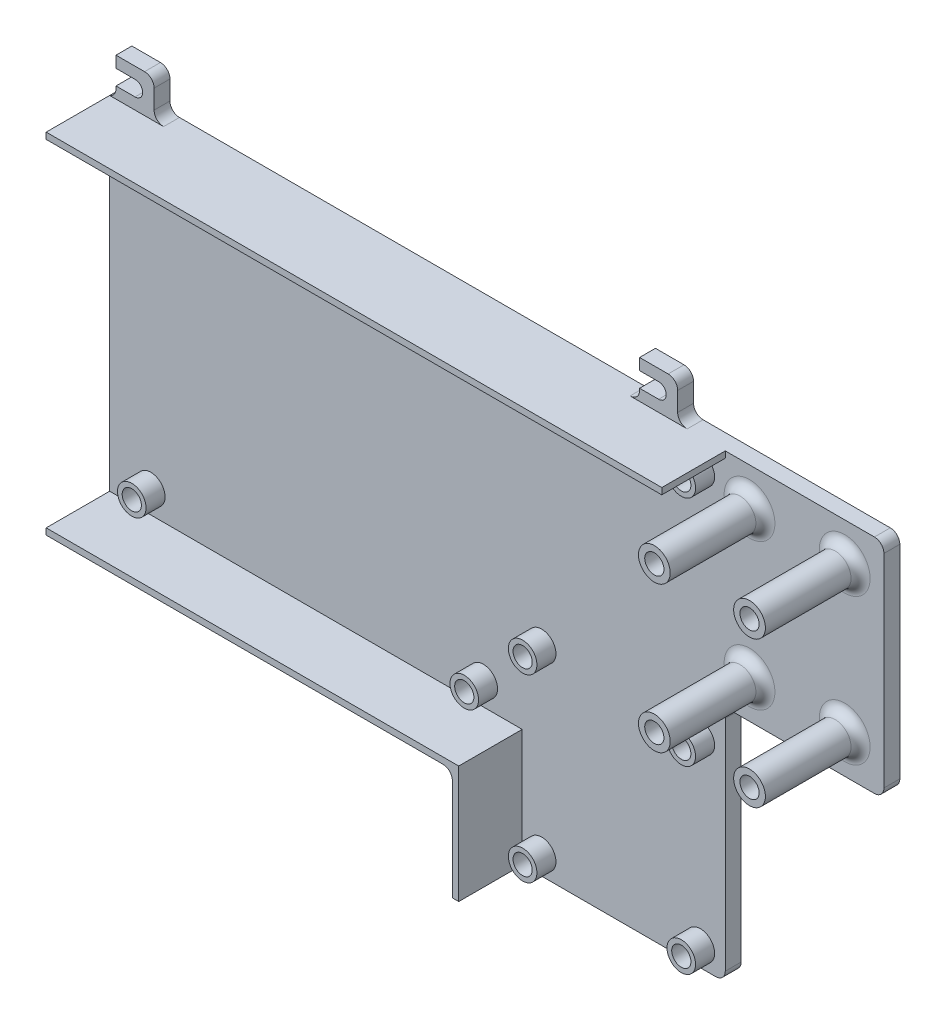
from build123d import *

# Parameters (mm, degrees)
SKETCH1_W            = 128
SKETCH1_H            = 110
SKETCH1_W_2          = 50
SKETCH1_H_2          = 70
BOSS_EXTRUDE1_DEPTH  = 5
SKETCH2_R            = 4.5
SKETCH2_R_2          = 3.025
SKETCH2_R_3          = 4.411768353
BOSS_EXTRUDE2_DEPTH  = 6
SKETCH3_W            = 194
SKETCH3_H            = 2
BOSS_EXTRUDE3_DEPTH  = 20
SKETCH6_W            = 12
SKETCH6_H            = 12
BOSS_EXTRUDE5_DEPTH  = 5
M4_CLEARANCE_HOLE1_D = 4.8
CUT_EXTRUDE1_DEPTH   = 329.83563266
FILLET2_R            = 3
FILLET3_R            = 3
SKETCH11_R           = 5
SKETCH11_R_2         = 3.025
BOSS_EXTRUDE6_DEPTH  = 30
FILLET4_R            = 3


with BuildPart() as part:
    # Sketch1 → Boss-Extrude1 (new body)
    with BuildSketch(Plane.XY):
        with Locations((-103.32475602, 215.37439567)):
            Rectangle(SKETCH1_W, SKETCH1_H)
        Polygon((26.67524398, 270.37439567), (-39.32475602, 270.37439567), (-39.32475602, 160.37439567), (-39.32475602, 125.37439567), (26.67524398, 125.37439567), (26.67524398, 195.37439567), (26.67524398, 200.37439567), align=None)
        with Locations((51.67524398, 235.37439567)):
            Rectangle(SKETCH1_W_2, SKETCH1_H_2)
    extrude(amount=BOSS_EXTRUDE1_DEPTH)

    # Sketch2 → Boss-Extrude2 (add)
    # profile 1 of 10: a face of its own
    with BuildSketch(Plane.XY.offset(5)):
        with Locations((-49.57975602, 169.52739567)):
            Circle(SKETCH2_R)
        with Locations((-49.57975602, 169.52739567)):
            Circle(SKETCH2_R_2, mode=Mode.SUBTRACT)
    # profile 2 of 10: a face of its own
    with BuildSketch(Plane.XY.offset(5)):
        with Locations((-31.18175602, 188.30539567)):
            Circle(SKETCH2_R)
        with Locations((-31.18175602, 188.30539567)):
            Circle(SKETCH2_R_2, mode=Mode.SUBTRACT)
    # profile 3 of 10: a face of its own
    with BuildSketch(Plane.XY.offset(5)):
        with Locations((-31.18175602, 131.55539567)):
            Circle(SKETCH2_R)
        with Locations((-31.18175602, 131.55539567)):
            Circle(SKETCH2_R_2, mode=Mode.SUBTRACT)
    # profile 4 of 10: a face of its own
    with BuildSketch(Plane.XY.offset(5)):
        with Locations((18.81824398, 131.55539567)):
            Circle(SKETCH2_R)
        with Locations((18.81824398, 131.55539567)):
            Circle(SKETCH2_R_2, mode=Mode.SUBTRACT)
    # profile 5 of 10: a face of its own
    with BuildSketch(Plane.XY.offset(5)):
        with Locations((18.81824398, 188.30539567)):
            Circle(SKETCH2_R)
        with Locations((18.81824398, 188.30539567)):
            Circle(SKETCH2_R_2, mode=Mode.SUBTRACT)
    # profile 6 of 10: a face of its own
    with BuildSketch(Plane.XY.offset(5)):
        with Locations((18.81824398, 261.55539567)):
            Circle(SKETCH2_R)
        with Locations((18.81824398, 261.55539567)):
            Circle(SKETCH2_R_2, mode=Mode.SUBTRACT)
    # profile 7 of 10: a face of its own
    with BuildSketch(Plane.XY.offset(5)):
        with Locations((-49.57975602, 262.49139567)):
            Circle(SKETCH2_R_3)
        with Locations((-49.57975602, 262.49139567)):
            Circle(SKETCH2_R_2, mode=Mode.SUBTRACT)
    # profile 8 of 10: a face of its own
    with BuildSketch(Plane.XY.offset(5)):
        with Locations((-154.35475602, 262.49139567)):
            Circle(SKETCH2_R)
        with Locations((-154.35475602, 262.49139567)):
            Circle(SKETCH2_R_2, mode=Mode.SUBTRACT)
    # profile 9 of 10: a face of its own
    with BuildSketch(Plane.XY.offset(5)):
        with Locations((-154.35475602, 169.52739567)):
            Circle(SKETCH2_R)
        with Locations((-154.35475602, 169.52739567)):
            Circle(SKETCH2_R_2, mode=Mode.SUBTRACT)
    # profile 10 of 10: a face of its own
    with BuildSketch(Plane.XY.offset(5)):
        with Locations((-31.18175602, 261.55539567)):
            Circle(SKETCH2_R)
        with Locations((-31.18175602, 261.55539567)):
            Circle(SKETCH2_R_2, mode=Mode.SUBTRACT)
    extrude(amount=BOSS_EXTRUDE2_DEPTH)

    # Sketch3 → Boss-Extrude3 (add)
    with BuildSketch(Plane.XY.offset(5)):
        with Locations((-70.32475602, 269.37439567)):
            Rectangle(SKETCH3_W, SKETCH3_H)
        Polygon((-167.32475602, 162.37439567), (-167.32475602, 160.37439567), (-39.32475602, 160.37439567), (-39.32475602, 125.37439567), (-37.32475602, 125.37439567), (-37.32475602, 162.37439567), align=None)
    extrude(amount=BOSS_EXTRUDE3_DEPTH)

    # Sketch6 → Boss-Extrude5 (add)
    with BuildSketch(Plane(origin=(0, 0, 0), x_dir=(-1, 0, 0), z_dir=(0, 0, -1))):
        with Locations((131.32475602, 154.37439567)):
            Rectangle(SKETCH6_W, SKETCH6_H)
        with Locations((159.32475602, 276.37439567)):
            Rectangle(SKETCH6_W, SKETCH6_H)
        with Locations((45.32475602, 154.37439567)):
            Rectangle(SKETCH6_W, SKETCH6_H)
        with Locations((-5.67524398, 276.37439567)):
            Rectangle(SKETCH6_W, SKETCH6_H)
    extrude(amount=-BOSS_EXTRUDE5_DEPTH)

    # M4 Clearance Hole1 (through all)
    with Locations(Plane.XY.offset(5)):
        with Locations((-131.32475602, 154.37439567), (-159.32475602, 276.37439567), (5.67524398, 276.37439567), (-45.32475602, 154.37439567)):
            Hole(M4_CLEARANCE_HOLE1_D / 2)

    # Sketch10 → Cut-Extrude1 (cut, through all)
    with BuildSketch(Plane.XY.offset(5)):
        with BuildLine():
            ThreePointArc((-131.32475602, 151.97439567), (-133.72475602, 154.37439567), (-131.32475602, 156.77439567))
            Line((-131.32475602, 156.77439567), (-137.32475602, 156.77439567))
            Line((-137.32475602, 156.77439567), (-137.32475602, 151.97439567))
            Line((-137.32475602, 151.97439567), (-131.32475602, 151.97439567))
        make_face()
        with BuildLine():
            ThreePointArc((-159.32475602, 273.97439567), (-161.72475602, 276.37439567), (-159.32475602, 278.77439567))
            Line((-159.32475602, 278.77439567), (-165.32475602, 278.77439567))
            Line((-165.32475602, 278.77439567), (-165.32475602, 273.97439567))
            Line((-165.32475602, 273.97439567), (-159.32475602, 273.97439567))
        make_face()
        with BuildLine():
            ThreePointArc((5.67524398, 273.97439567), (3.27524398, 276.37439567), (5.67524398, 278.77439567))
            Line((5.67524398, 278.77439567), (-0.32475602, 278.77439567))
            Line((-0.32475602, 278.77439567), (-0.32475602, 273.97439567))
            Line((-0.32475602, 273.97439567), (5.67524398, 273.97439567))
        make_face()
        with BuildLine():
            ThreePointArc((-45.32475602, 151.97439567), (-47.72475602, 154.37439567), (-45.32475602, 156.77439567))
            Line((-45.32475602, 156.77439567), (-51.32475602, 156.77439567))
            Line((-51.32475602, 156.77439567), (-51.32475602, 151.97439567))
            Line((-51.32475602, 151.97439567), (-45.32475602, 151.97439567))
        make_face()
    extrude(amount=-CUT_EXTRUDE1_DEPTH, mode=Mode.SUBTRACT)

    # Fillet2
    # the kernel refuses this fillet: 3 mm, written as the material it adds along each edge
    with BuildSketch(Plane(origin=(-137.32475602, 160.37439567, 0), x_dir=(-1, 0, 0), z_dir=(0, 0, 1)), Plane(origin=(-153.32475602, 270.37439567, 0), x_dir=(1, 0, 0), z_dir=(0, 0, 1)), Plane(origin=(-51.32475602, 160.37439567, 0), x_dir=(-1, 0, 0), z_dir=(0, 0, 1)), Plane(origin=(11.67524398, 270.37439567, 0), x_dir=(1, 0, 0), z_dir=(0, 0, 1))) as fillet2_piece_1:
        with BuildLine():
            CenterArc((FILLET2_R, FILLET2_R), FILLET2_R, 180, 90)
            Line((0, FILLET2_R), (0, 0))
            Line((0, 0), (FILLET2_R, 0))
        make_face()
    extrude(amount=5)
    with BuildSketch(Plane(origin=(-125.32475602, 160.37439567, 0), x_dir=(1, 0, 0), z_dir=(0, 0, 1)), Plane(origin=(-39.32475602, 148.37439567, 0), x_dir=(0, -1, 0), z_dir=(0, 0, 1)), Plane(origin=(-0.32475602, 270.37439567, 0), x_dir=(-1, 0, 0), z_dir=(0, 0, 1))) as fillet2_piece_2:
        with BuildLine():
            CenterArc((FILLET2_R, -FILLET2_R), FILLET2_R, 90, 90)
            Line((0, -FILLET2_R), (0, 0))
            Line((0, 0), (FILLET2_R, 0))
        make_face()
    extrude(amount=5)
    with BuildSketch(Plane(origin=(-165.32475602, 270.37439567, 0), x_dir=(-1, 0, 0), z_dir=(0, 0, 1))) as fillet2_piece_3:
        with BuildLine():
            CenterArc((3, -2.828427125), FILLET2_R, 109.471220634, 70.528779366)
            Line((0, -2.828427125), (0, 0))
            Line((0, 0), (2, 0))
        make_face()
    extrude(amount=5)
    # the kernel refuses this fillet: 3 mm, written as the material it takes off along each edge
    with BuildSketch(Plane(origin=(-125.32475602, 148.37439567, -7.5), x_dir=(0, 1, 0), z_dir=(0, 0, 1))) as fillet2_2_piece_1:
        with BuildLine():
            CenterArc((FILLET2_R, FILLET2_R), FILLET2_R, 180, 90)
            Line((0, FILLET2_R), (0, 0))
            Line((0, 0), (FILLET2_R, 0))
        make_face()
    extrude(amount=20, mode=Mode.SUBTRACT)
    with BuildSketch(Plane(origin=(-153.32475602, 282.37439567, -7.5), x_dir=(0, -1, 0), z_dir=(0, 0, 1)), Plane(origin=(11.67524398, 282.37439567, -7.5), x_dir=(0, -1, 0), z_dir=(0, 0, 1))) as fillet2_2_piece_2:
        with BuildLine():
            CenterArc((FILLET2_R, -FILLET2_R), FILLET2_R, 90, 90)
            Line((0, -FILLET2_R), (0, 0))
            Line((0, 0), (FILLET2_R, 0))
        make_face()
    extrude(amount=20, mode=Mode.SUBTRACT)

    # Fillet3
    fillet3_edges = [part.edges().sort_by_distance(p)[0] for p in [
        (76.67524398, 270.37439567, 2.5),
        (76.67524398, 200.37439567, 2.5),
        (26.67524398, 200.37439567, 2.5),
        (26.67524398, 125.37439567, 2.5),
        (-39.32475602, 160.37439567, 15),
    ]]
    fillet(fillet3_edges, radius=FILLET3_R)

    # Sketch11 → Boss-Extrude6 (add)
    # profile 1 of 4: a face of its own
    with BuildSketch(Plane.XY.offset(5)):
        with Locations((34.31824398, 258.37439567)):
            Circle(SKETCH11_R)
        with Locations((34.31824398, 258.37439567)):
            Circle(SKETCH11_R_2, mode=Mode.SUBTRACT)
    # profile 2 of 4: a face of its own
    with BuildSketch(Plane.XY.offset(5)):
        with Locations((64.31824398, 258.37439567)):
            Circle(SKETCH11_R)
        with Locations((64.31824398, 258.37439567)):
            Circle(SKETCH11_R_2, mode=Mode.SUBTRACT)
    # profile 3 of 4: a face of its own
    with BuildSketch(Plane.XY.offset(5)):
        with Locations((64.31824398, 212.37439567)):
            Circle(SKETCH11_R)
        with Locations((64.31824398, 212.37439567)):
            Circle(SKETCH11_R_2, mode=Mode.SUBTRACT)
    # profile 4 of 4: a face of its own
    with BuildSketch(Plane.XY.offset(5)):
        with Locations((34.31824398, 212.37439567)):
            Circle(SKETCH11_R)
        with Locations((34.31824398, 212.37439567)):
            Circle(SKETCH11_R_2, mode=Mode.SUBTRACT)
    extrude(amount=BOSS_EXTRUDE6_DEPTH)

    # Fillet4
    fillet4_edges = [part.edges().sort_by_distance(p)[0] for p in [
        (29.31824398, 258.37439567, 5),
        (59.31824398, 258.37439567, 5),
        (59.31824398, 212.37439567, 5),
        (29.31824398, 212.37439567, 5),
    ]]
    fillet(fillet4_edges, radius=FILLET4_R)


solid = part.part
